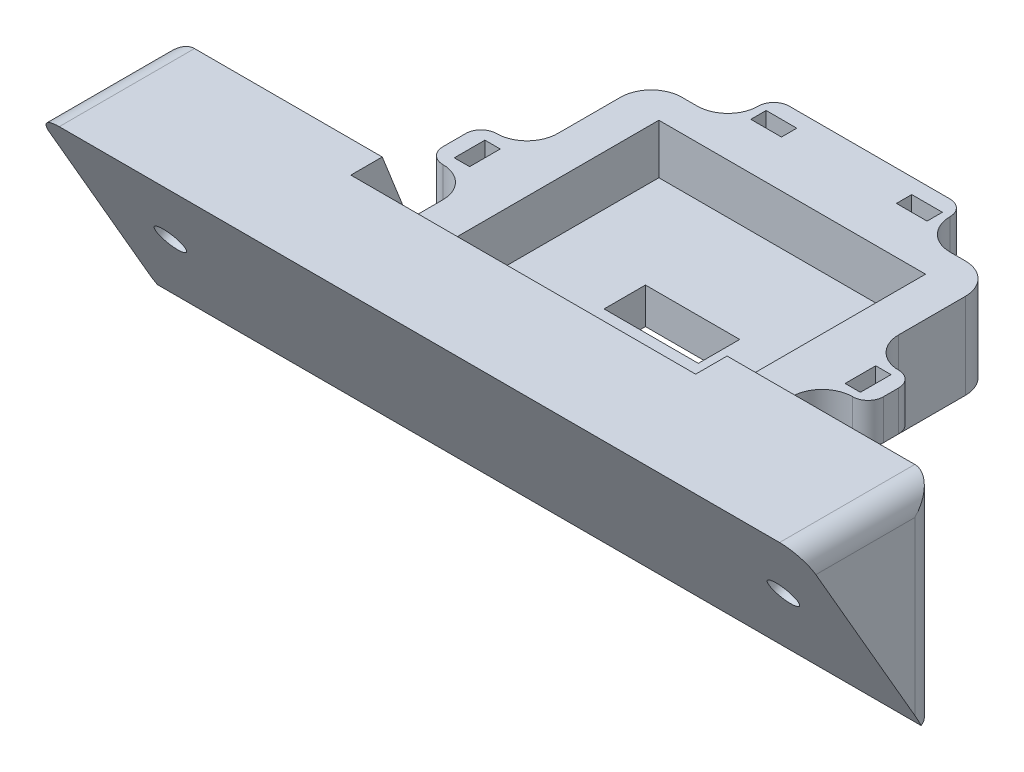
from build123d import *

# Parameters (mm, degrees)
SKETCH2_W           = 57.15
SKETCH2_H           = 49.784
BOSS_EXTRUDE1_DEPTH = 14.224
SKETCH3_W           = 44.196
SKETCH3_H           = 39.37
CUT_EXTRUDE1_DEPTH  = 8.255
SKETCH4_W           = 35.56
SKETCH4_H           = 4.191
SKETCH4_W_2         = 15.621
SKETCH4_H_2         = 6.858
CUT_EXTRUDE2_DEPTH  = 8.255
SKETCH5_W           = 7.62
SKETCH5_H           = 8.89
SKETCH5_H_2         = 7.62
BOSS_EXTRUDE2_DEPTH = 6.604
SKETCH6_W           = 2.54
SKETCH6_H           = 5.08
SKETCH6_W_2         = 5.08
SKETCH6_H_2         = 2.54
CUT_EXTRUDE3_DEPTH  = 6.604
FILLET1_R           = 5.08
FILLET2_R           = 2.54
SKETCH7_W           = 127
SKETCH7_H           = 14.224
SKETCH7_R           = 2.38125
BOSS_EXTRUDE3_DEPTH = 5.207
BOSS_EXTRUDE4_DEPTH = 127
SKETCH11_W          = 34.925
SKETCH11_H          = 11.176
BOSS_EXTRUDE5_DEPTH = 5.207
SKETCH9_R           = 2.413
CUT_EXTRUDE4_DEPTH  = 25.4
FILLET3_R           = 5.08
FILLET4_R           = 5.08
BOSS_EXTRUDE6_DEPTH = 6.35
BOSS_EXTRUDE7_DEPTH = 6.35
BOSS_EXTRUDE8_DEPTH = 127
BOSS_EXTRUDE9_DEPTH = 127
CUT_EXTRUDE6_START  = -2.199704526
SKETCH16_R          = 2.413
CUT_EXTRUDE6_DEPTH  = 2.199704526
CUT_EXTRUDE9_START  = -17.813215
SKETCH17_R          = 5.08
CUT_EXTRUDE9_DEPTH  = 7.653215
FILLET5_R           = 3.81


with BuildPart() as part:
    # Sketch2 → Boss-Extrude1 (new body)
    with BuildSketch(Plane(origin=(0, 0, 0), x_dir=(1, 0, 0), z_dir=(0, 1, 0))):
        with Locations((28.575, 24.892)):
            Rectangle(SKETCH2_W, SKETCH2_H)
    extrude(amount=BOSS_EXTRUDE1_DEPTH)

    # Sketch3 → Cut-Extrude1 (cut)
    with BuildSketch(Plane(origin=(0, 14.224, 0), x_dir=(1, 0, 0), z_dir=(0, 1, 0))):
        with Locations((28.575, 24.892)):
            Rectangle(SKETCH3_W, SKETCH3_H)
    extrude(amount=-CUT_EXTRUDE1_DEPTH, mode=Mode.SUBTRACT)

    # Sketch4 → Cut-Extrude2 (cut)
    with BuildSketch(Plane(origin=(0, 5.969, 0), x_dir=(1, 0, 0), z_dir=(0, 1, 0))):
        with Locations((28.575, 12.5095)):
            Rectangle(SKETCH4_W, SKETCH4_H)
        with Locations((28.575, 24.638)):
            Rectangle(SKETCH4_W_2, SKETCH4_H_2)
    extrude(amount=-CUT_EXTRUDE2_DEPTH, mode=Mode.SUBTRACT)

    # Sketch5 → Boss-Extrude2 (add)
    with BuildSketch(Plane(origin=(0, 14.224, 0), x_dir=(1, 0, 0), z_dir=(0, 1, 0))):
        with Locations((-3.81, 24.765)):
            Rectangle(SKETCH5_W, SKETCH5_H)
        Polygon((12.7, 49.784), (36.83, 49.784), (44.45, 49.784), (44.45, 57.404), (36.83, 57.404), (12.7, 57.404), align=None)
        with Locations((60.96, 24.765)):
            Rectangle(SKETCH5_W, SKETCH5_H_2)
    extrude(amount=-BOSS_EXTRUDE2_DEPTH)

    # Sketch6 → Cut-Extrude3 (cut)
    with BuildSketch(Plane(origin=(0, 14.224, 0), x_dir=(1, 0, 0), z_dir=(0, 1, 0))):
        with Locations((-3.81, 24.765)):
            Rectangle(SKETCH6_W, SKETCH6_H)
        with Locations((60.96, 24.765)):
            Rectangle(SKETCH6_W, SKETCH6_H)
        with Locations((16.51, 53.594)):
            Rectangle(SKETCH6_W_2, SKETCH6_H_2)
        with Locations((40.64, 53.594)):
            Rectangle(SKETCH6_W_2, SKETCH6_H_2)
    extrude(amount=-CUT_EXTRUDE3_DEPTH, mode=Mode.SUBTRACT)

    # Fillet1
    fillet1_edges = [part.edges().sort_by_distance(p)[0] for p in [
        (0, 7.112, -49.784),
        (57.15, 7.112, -49.784),
        (57.15, 7.112, 0),
        (0, 7.112, 0),
    ]]
    fillet(fillet1_edges, radius=FILLET1_R)

    # Fillet2
    fillet2_edges = [part.edges().sort_by_distance(p)[0] for p in [
        (-7.62, 10.922, -20.32),
        (-7.62, 10.922, -29.21),
        (12.7, 10.922, -57.404),
        (44.45, 10.922, -57.404),
        (64.77, 10.922, -28.575),
        (64.77, 10.922, -20.955),
    ]]
    fillet(fillet2_edges, radius=FILLET2_R)

    # Sketch7 → Boss-Extrude3 (add)
    with BuildSketch(Plane.XY):
        with Locations((28.575, 7.112)):
            Rectangle(SKETCH7_W, SKETCH7_H)
        with Locations((-30.861, 7.112)):
            Circle(SKETCH7_R, mode=Mode.SUBTRACT)
        with Locations((88.011, 7.112)):
            Circle(SKETCH7_R, mode=Mode.SUBTRACT)
    extrude(amount=-BOSS_EXTRUDE3_DEPTH)

    # Sketch8 → Boss-Extrude4 (add)
    with BuildSketch(Plane.ZY.offset(34.925)):
        Polygon((0, 25.4), (14.664696837, 25.4), (0, 0), (-5.207, 0), (-5.207, 14.224), (0, 14.224), align=None)
    extrude(amount=-BOSS_EXTRUDE4_DEPTH)

    # Sketch11 → Boss-Extrude5 (add)
    with BuildSketch(Plane(origin=(0, 0, 0), x_dir=(-1, 0, 0), z_dir=(0, 0, -1))):
        with Locations((17.4625, 19.812)):
            Rectangle(SKETCH11_W, SKETCH11_H)
        with Locations((-74.6125, 19.812)):
            Rectangle(SKETCH11_W, SKETCH11_H)
    extrude(amount=BOSS_EXTRUDE5_DEPTH)

    # Sketch9 → Cut-Extrude4 (cut, symmetric)
    with BuildSketch(Plane(origin=(0, 0, 0), x_dir=(1, 0, 0), z_dir=(0, -0.5000000000000043, 0.8660254037844363))):
        with Locations(Location((-22.225, 11.549393675, 0), (0, 0, 270))):
            Circle(SKETCH9_R)
        with Locations(Location((79.375, 11.549393675, 0), (0, 0, 270))):
            Circle(SKETCH9_R)
    extrude(amount=CUT_EXTRUDE4_DEPTH, both=True, mode=Mode.SUBTRACT)

    # Fillet3
    fillet3_edges = [part.edges().sort_by_distance(p)[0] for p in [
        (44.45, 10.922, -49.784),
        (12.7, 10.922, -49.784),
    ]]
    fillet(fillet3_edges, radius=FILLET3_R - 0.0001)  # a hair under: the kernel refuses the full size

    # Fillet4
    fillet4_edges = [part.edges().sort_by_distance(p)[0] for p in [
        (57.15, 10.922, -20.955),
        (57.15, 10.922, -28.575),
        (0, 10.922, -29.21),
        (0, 10.922, -20.32),
    ]]
    fillet(fillet4_edges, radius=FILLET4_R - 0.0001)  # a hair under: the kernel refuses the full size

    # Sketch12 → Boss-Extrude6 (add)
    with BuildSketch(Plane.ZY):
        Polygon((-5.207, 25.4), (-15.24, 0), (-5.207, 0), align=None)
    extrude(amount=BOSS_EXTRUDE6_DEPTH)

    # Sketch13 → Boss-Extrude7 (add)
    with BuildSketch(Plane(origin=(57.15, 0, 0), x_dir=(0, 0, -1), z_dir=(1, 0, 0))):
        Polygon((5.207, 25.4), (15.875, 0), (5.207, 0), align=None)
    extrude(amount=BOSS_EXTRUDE7_DEPTH)

    # Sketch14 → Boss-Extrude8 (add)
    with BuildSketch(Plane.ZY.offset(34.925)):
        Polygon((-5.207, 0), (-5.207, -9.018788555), (0, 0), align=None)
    extrude(amount=-BOSS_EXTRUDE8_DEPTH)

    # Sketch15 → Boss-Extrude9 (add)
    with BuildSketch(Plane(origin=(92.075, 0, 0), x_dir=(0, 0, -1), z_dir=(1, 0, 0))):
        Polygon((5.207, -9.018788555), (2.667, -9.018788555), (-17.204696837, 25.4), (-14.664696837, 25.4), align=None)
    extrude(amount=-BOSS_EXTRUDE9_DEPTH)

    # Sketch16 → Cut-Extrude6 (cut)
    with BuildSketch(Plane(origin=(0, 0, 0), x_dir=(-1, 0, 0), z_dir=(0, 0.5000000000000031, -0.8660254037844369)).offset(CUT_EXTRUDE6_START)):
        with Locations(Location((-79.375, 11.549393675, 0), (0, 0, 270))):
            Circle(SKETCH16_R)
        with Locations(Location((22.225, 11.549393675, 0), (0, 0, 270))):
            Circle(SKETCH16_R)
    extrude(amount=CUT_EXTRUDE6_DEPTH, mode=Mode.SUBTRACT)

    # Sketch17 → Cut-Extrude9 (cut)
    with BuildSketch(Plane(origin=(0, -1.099852263, 1.905), x_dir=(1, 0, 0), z_dir=(0, -0.500000000000003, 0.8660254037844369)).offset(CUT_EXTRUDE9_START)):
        with Locations(Location((79.375, 11.549393675, 0), (0, 0, 90))):
            Circle(SKETCH17_R)
        with Locations(Location((-22.225, 11.549393675, 0), (0, 0, 90))):
            Circle(SKETCH17_R)
    extrude(amount=CUT_EXTRUDE9_DEPTH, mode=Mode.SUBTRACT)

    # Fillet5
    fillet5_edges = [part.edges().sort_by_distance(p)[0] for p in [
        (92.075, 25.4, 5.998848419),
        (92.075, 8.190605722, -5.207),
        (-34.925, 25.4, 5.998848419),
        (-34.925, 8.190605722, -5.207),
    ]]
    fillet(fillet5_edges, radius=FILLET5_R)


solid = part.part
